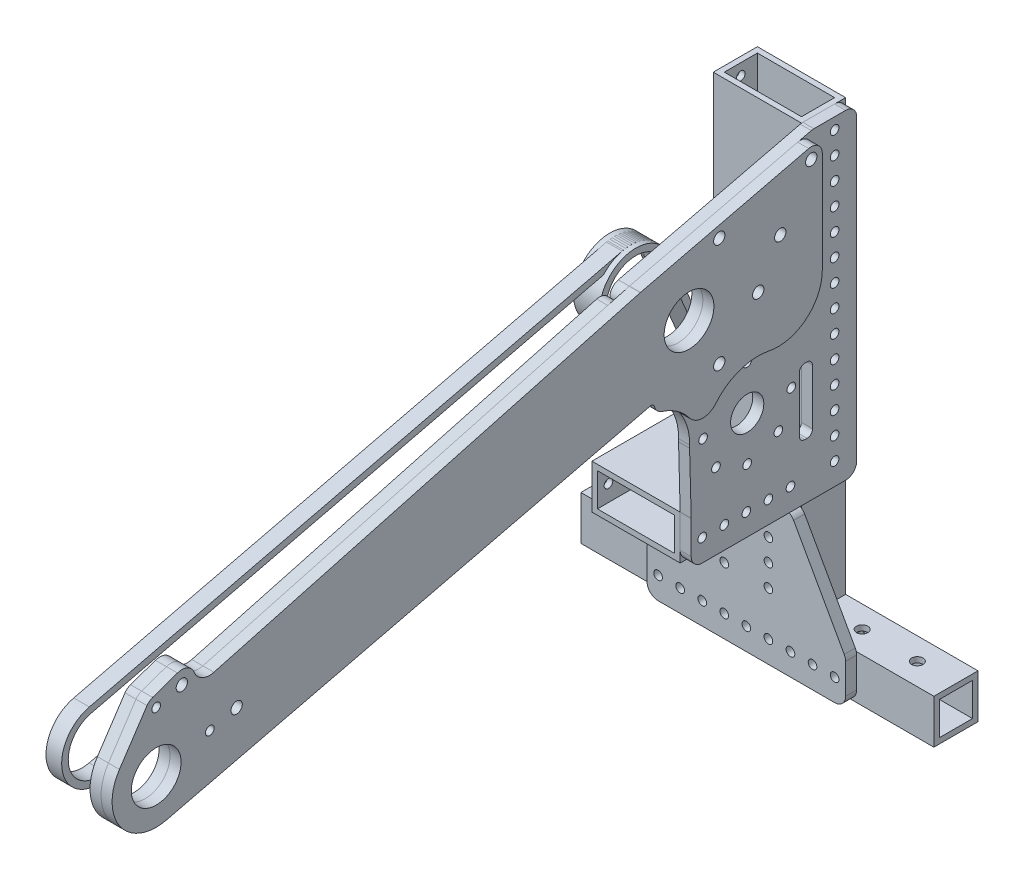
from build123d import *

# Parameters (mm, degrees)
CROQUIS1_W                  = 203.2
CROQUIS1_H                  = 25.4
SALIENTE_EXTRUIR1_DEPTH     = 25.4
VACIADO1_T                  = -3.175
CROQUIS2_W                  = 50.8
CROQUIS2_H                  = 25.4
CROQUIS2_W_2                = 44.45
CROQUIS2_H_2                = 19.05
SALIENTE_EXTRUIR2_DEPTH     = 247.65
CROQUIS3_R                  = 3.2639
CORTAR_EXTRUIR1_DEPTH       = 268.982037644
CROQUIS4_R                  = 14.3129
CROQUIS4_R_2                = 2.4892
CORTAR_EXTRUIR2_DEPTH       = 293.444905068
CROQUIS8_R                  = 2.4892
CORTAR_EXTRUIR4_DEPTH       = 293.444905068
CROQUIS6_W                  = 50.8
CROQUIS6_H                  = 25.4
CROQUIS6_W_2                = 44.45
CROQUIS6_H_2                = 19.05
SALIENTE_EXTRUIR3_DEPTH     = 69.85
CORTAR_EXTRUIR3_DEPTH       = 3.175
CROQUIS9_R                  = 2.4892
SALIENTE_EXTRUIR4_DEPTH     = 6.35
CROQUIS16_R                 = 14.3256
CROQUIS16_R_2               = 2.4892
CROQUIS16_R_3               = 9.5631
SALIENTE_EXTRUIR5_DEPTH     = 6.35
CORTAR_EXTRUIR5_DEPTH       = 326.296833976
CORTAR_EXTRUIR5_DEPTH_BACK  = 326.296833976
CROQUIS12_R                 = 2.4892
SALIENTE_EXTRUIR6_OUTLINE_R = 14.3256
SALIENTE_EXTRUIR6_DEPTH     = 6.35
SALIENTE_EXTRUIR7_START     = -12.7
SALIENTE_EXTRUIR7_OUTLINE_R = 14.3256
SALIENTE_EXTRUIR7_DEPTH     = 6.35
CROQUIS22_R                 = 2.4892
CROQUIS22_R_2               = 3.2639
CORTAR_EXTRUIR6_DEPTH       = 522.908582153
CORTAR_EXTRUIR8_DEPTH       = 521.244846803
SALIENTE_EXTRUIR9_DEPTH     = 4.5
SALIENTE_EXTRUIR10_DEPTH    = 7.5


# Read off the part's stored shape, not the designer's step: Saliente-Extruir6, Saliente-Extruir7
with BuildPart() as part:
    # Croquis1 → Saliente-Extruir1 (new body)
    with BuildSketch(Plane(origin=(0, 0, 0), x_dir=(1, 0, 0), z_dir=(0, 1, 0))):
        Rectangle(CROQUIS1_W, CROQUIS1_H)
    extrude(amount=SALIENTE_EXTRUIR1_DEPTH)

    # Vaciado1
    vaciado1_openings = [part.faces().sort_by_distance(p)[0] for p in [
        (-101.6, 12.7, 0),
        (101.6, 12.7, 0),
    ]]
    offset(amount=VACIADO1_T, openings=vaciado1_openings, kind=Kind.INTERSECTION)

    # Croquis3 → Cortar-Extruir1 (cut, through all)
    with BuildSketch(Plane(origin=(0, 25.4, 0), x_dir=(1, 0, 0), z_dir=(0, 1, 0))):
        with Locations(Location((-47.625, 0, 0), (0, 0, 270))):
            Circle(CROQUIS3_R)
        with Locations(Location((-79.375, 0, 0), (0, 0, 270))):
            Circle(CROQUIS3_R)
        with Locations(Location((79.375, 0, 0), (0, 0, 90))):
            Circle(CROQUIS3_R)
        with Locations(Location((47.625, 0, 0), (0, 0, 90))):
            Circle(CROQUIS3_R)
    extrude(amount=-CORTAR_EXTRUIR1_DEPTH, mode=Mode.SUBTRACT)


with BuildPart() as body_2:
    # Croquis2 → Saliente-Extruir2 (new body)
    with BuildSketch(Plane(origin=(0, 25.4, 0), x_dir=(1, 0, 0), z_dir=(0, 1, 0))):
        Rectangle(CROQUIS2_W, CROQUIS2_H)
        Rectangle(CROQUIS2_W_2, CROQUIS2_H_2, mode=Mode.SUBTRACT)
    extrude(amount=SALIENTE_EXTRUIR2_DEPTH)

    # Croquis4 → Cortar-Extruir2 (cut, through all)
    with BuildSketch(Plane.XY.offset(12.7)):
        with Locations((0, 139.6619)):
            Circle(CROQUIS4_R)
        with Locations((-11.90625, 160.284129928)):
            Circle(CROQUIS4_R_2)
        with Locations((11.90625, 160.284129928)):
            Circle(CROQUIS4_R_2)
        with Locations((11.90625, 119.039670072)):
            Circle(CROQUIS4_R_2)
        with Locations((-11.90625, 119.039670072)):
            Circle(CROQUIS4_R_2)
    extrude(amount=-CORTAR_EXTRUIR2_DEPTH, mode=Mode.SUBTRACT)


with BuildPart() as cortar_extruir4_tool:
    # Croquis8 → Cortar-Extruir4 (new, through all)
    with BuildSketch(Plane.XY.offset(12.7)):
        with Locations((-50.8, 12.7)):
            Circle(CROQUIS8_R)
        with Locations((-38.1, 12.7)):
            Circle(CROQUIS8_R)
        with Locations((-25.4, 12.7)):
            Circle(CROQUIS8_R)
        with Locations((-12.7, 12.7)):
            Circle(CROQUIS8_R)
        with Locations((0, 12.7)):
            Circle(CROQUIS8_R)
        with Locations((12.7, 12.7)):
            Circle(CROQUIS8_R)
        with Locations((25.4, 12.7)):
            Circle(CROQUIS8_R)
        with Locations((38.1, 12.7)):
            Circle(CROQUIS8_R)
        with Locations((50.8, 12.7)):
            Circle(CROQUIS8_R)
        with Locations((12.7, 38.1)):
            Circle(CROQUIS8_R)
        with Locations((-12.7, 50.8)):
            Circle(CROQUIS8_R)
        with Locations((12.7, 50.8)):
            Circle(CROQUIS8_R)
        with Locations((-12.7, 63.5)):
            Circle(CROQUIS8_R)
        with Locations((12.7, 63.5)):
            Circle(CROQUIS8_R)
        with Locations((12.7, 76.2)):
            Circle(CROQUIS8_R)
        with Locations((-12.7, 76.2)):
            Circle(CROQUIS8_R)
        with Locations((-12.7, 38.1)):
            Circle(CROQUIS8_R)
    extrude(amount=-CORTAR_EXTRUIR4_DEPTH)


with BuildPart() as part_1:
    add(part.part)

    # Cortar-Extruir4: cut by cortar_extruir4_tool
    add(cortar_extruir4_tool.part, mode=Mode.SUBTRACT)


with BuildPart() as body_2_1:
    add(body_2.part)

    # Cortar-Extruir4: cut by cortar_extruir4_tool
    add(cortar_extruir4_tool.part, mode=Mode.SUBTRACT)


with BuildPart() as body_3:
    # Croquis6 → Saliente-Extruir3 (new body)
    with BuildSketch(Plane.XY.offset(12.7)):
        with Locations((0, 101.346)):
            Rectangle(CROQUIS6_W, CROQUIS6_H)
        with Locations((0, 101.346)):
            Rectangle(CROQUIS6_W_2, CROQUIS6_H_2, mode=Mode.SUBTRACT)
    extrude(amount=SALIENTE_EXTRUIR3_DEPTH)

    # Croquis7 → Cortar-Extruir3 (cut)
    with BuildSketch(Plane(origin=(0, 114.046, 0), x_dir=(1, 0, 0), z_dir=(0, 1, 0))):
        with BuildLine():
            Line((16.51, -12.7), (-16.51, -12.7))
            Line((-16.51, -12.7), (-16.51, -34.798))
            ThreePointArc((-16.51, -34.798), (-15.542866591, -37.132866591), (-13.208, -38.1))
            Line((-13.208, -38.1), (13.208, -38.1))
            ThreePointArc((13.208, -38.1), (15.542866591, -37.132866591), (16.51, -34.798))
            Line((16.51, -34.798), (16.51, -12.7))
        make_face()
    extrude(amount=-CORTAR_EXTRUIR3_DEPTH, mode=Mode.SUBTRACT)


with BuildPart() as body_4:
    # Croquis9 → Saliente-Extruir4 (new body)
    with BuildSketch(Plane.XY.offset(12.7)):
        with BuildLine():
            Line((50.8, 0), (-50.8, 0))
            ThreePointArc((-50.8, 0), (-55.290128061, 1.859871939), (-57.15, 6.35))
            Line((-57.15, 6.35), (-57.15, 23.748133557))
            ThreePointArc((-57.15, 23.748133557), (-56.945468654, 25.346793942), (-56.345050385, 26.84246971))
            Line((-56.345050385, 26.84246971), (-27.216776701, 79.040336153))
            ThreePointArc((-27.216776701, 79.040336153), (-24.886805275, 81.421926158), (-21.671726315, 82.296))
            Line((-21.671726315, 82.296), (21.671726315, 82.296))
            ThreePointArc((21.671726315, 82.296), (24.886805275, 81.421926158), (27.216776701, 79.040336153))
            Line((27.216776701, 79.040336153), (56.345050385, 26.84246971))
            ThreePointArc((56.345050385, 26.84246971), (56.945468654, 25.346793942), (57.15, 23.748133557))
            Line((57.15, 23.748133557), (57.15, 6.35))
            ThreePointArc((57.15, 6.35), (55.290128061, 1.859871939), (50.8, 0))
        make_face()
        with Locations((-25.4, 12.7)):
            Circle(CROQUIS9_R, mode=Mode.SUBTRACT)
        with Locations((-12.7, 12.7)):
            Circle(CROQUIS9_R, mode=Mode.SUBTRACT)
        with Locations((0, 12.7)):
            Circle(CROQUIS9_R, mode=Mode.SUBTRACT)
        with Locations((12.7, 12.7)):
            Circle(CROQUIS9_R, mode=Mode.SUBTRACT)
        with Locations((-38.1, 12.7)):
            Circle(CROQUIS9_R, mode=Mode.SUBTRACT)
        with Locations((-50.8, 12.7)):
            Circle(CROQUIS9_R, mode=Mode.SUBTRACT)
        with Locations((25.4, 12.7)):
            Circle(CROQUIS9_R, mode=Mode.SUBTRACT)
        with Locations((38.1, 12.7)):
            Circle(CROQUIS9_R, mode=Mode.SUBTRACT)
        with Locations((50.8, 12.7)):
            Circle(CROQUIS9_R, mode=Mode.SUBTRACT)
        with Locations((-12.7, 76.2)):
            Circle(CROQUIS9_R, mode=Mode.SUBTRACT)
        with Locations((12.7, 63.5)):
            Circle(CROQUIS9_R, mode=Mode.SUBTRACT)
        with Locations((-12.7, 63.5)):
            Circle(CROQUIS9_R, mode=Mode.SUBTRACT)
        with Locations((12.7, 50.8)):
            Circle(CROQUIS9_R, mode=Mode.SUBTRACT)
        with Locations((-12.7, 50.8)):
            Circle(CROQUIS9_R, mode=Mode.SUBTRACT)
        with Locations((12.7, 38.1)):
            Circle(CROQUIS9_R, mode=Mode.SUBTRACT)
        with Locations((-12.7, 38.1)):
            Circle(CROQUIS9_R, mode=Mode.SUBTRACT)
        with Locations((12.7, 76.2)):
            Circle(CROQUIS9_R, mode=Mode.SUBTRACT)
    extrude(amount=SALIENTE_EXTRUIR4_DEPTH)


with BuildPart() as body_5:
    # Croquis16 → Saliente-Extruir5 (new body)
    with BuildSketch(Plane(origin=(25.4, 0, 0), x_dir=(0, 0, -1), z_dir=(1, 0, 0))):
        with BuildLine():
            ThreePointArc((-11.945854905, 273.05), (-12.694737131, 273.005685959), (-13.433167074, 272.873362334))
            Line((-13.433167074, 272.873362334), (-118.152464466, 247.643952992))
            ThreePointArc((-118.152464466, 247.643952992), (-122.082067186, 244.784128506), (-122.838514631, 239.983278488))
            Line((-122.838514631, 239.983278488), (-110.011655784, 186.743044919))
            ThreePointArc((-110.011655784, 186.743044919), (-108.476664641, 183.893536514), (-105.736611957, 182.170745975))
            ThreePointArc((-105.736611957, 182.170745975), (-89.428766191, 170.378135102), (-83.486417929, 151.150550701))
            ThreePointArc((-83.486417929, 151.150550701), (-83.494947428, 150.336939284), (-83.483521079, 149.523363394))
            Line((-83.483521079, 149.523363394), (-82.552197171, 114.129500883))
            ThreePointArc((-82.552197171, 114.129500883), (-82.550549317, 114.045992774), (-82.55, 113.962470214))
            Line((-82.55, 113.962470214), (-82.55, 94.996))
            ThreePointArc((-82.55, 94.996), (-80.690128061, 90.505871939), (-76.2, 88.646))
            Line((-76.2, 88.646), (6.35, 88.646))
            ThreePointArc((6.35, 88.646), (10.840128061, 90.505871939), (12.7, 94.996))
            Line((12.7, 94.996), (12.7, 266.7))
            ThreePointArc((12.7, 266.7), (10.840128061, 271.190128061), (6.35, 273.05))
            Line((6.35, 273.05), (-11.945854905, 273.05))
        make_face()
        with Locations((-90.151255112, 219.693162296)):
            Circle(CROQUIS16_R, mode=Mode.SUBTRACT)
        with Locations((-24.92, 150.396)):
            Circle(CROQUIS16_R_2, mode=Mode.SUBTRACT)
        with Locations((-50.32, 175.796)):
            Circle(CROQUIS16_R_2, mode=Mode.SUBTRACT)
        with Locations((-68.280512242, 132.435487758)):
            Circle(CROQUIS16_R_2, mode=Mode.SUBTRACT)
        with Locations((-75.72, 150.396)):
            Circle(CROQUIS16_R_2, mode=Mode.SUBTRACT)
        with Locations((-68.280512242, 168.356512242)):
            Circle(CROQUIS16_R_2, mode=Mode.SUBTRACT)
        with Locations((-50.32, 124.996)):
            Circle(CROQUIS16_R_2, mode=Mode.SUBTRACT)
        with Locations((-32.359487758, 132.435487758)):
            Circle(CROQUIS16_R_2, mode=Mode.SUBTRACT)
        with Locations((-50.32, 150.396)):
            Circle(CROQUIS16_R_3, mode=Mode.SUBTRACT)
    extrude(amount=SALIENTE_EXTRUIR5_DEPTH)


with BuildPart() as cortar_extruir5_tool:
    # Croquis12 → Cortar-Extruir5 (new, two sides: drawn at the far end of the back side and taken through both)
    with BuildSketch(Plane(origin=(25.4, 0, 0), x_dir=(0, 0, -1), z_dir=(1, 0, 0)).offset(-CORTAR_EXTRUIR5_DEPTH_BACK)):
        with Locations((0, 101.346)):
            Circle(CROQUIS12_R)
        with Locations((-25.4, 101.346)):
            Circle(CROQUIS12_R)
        with Locations((-38.1, 101.346)):
            Circle(CROQUIS12_R)
        with Locations((-50.8, 101.346)):
            Circle(CROQUIS12_R)
        with Locations((0, 114.046)):
            Circle(CROQUIS12_R)
        with Locations((0, 126.746)):
            Circle(CROQUIS12_R)
        with Locations((0, 139.446)):
            Circle(CROQUIS12_R)
        with Locations((0, 152.146)):
            Circle(CROQUIS12_R)
        with Locations((0, 164.846)):
            Circle(CROQUIS12_R)
        with Locations((0, 177.546)):
            Circle(CROQUIS12_R)
        with Locations((0, 190.246)):
            Circle(CROQUIS12_R)
        with Locations((0, 202.946)):
            Circle(CROQUIS12_R)
        with Locations((0, 215.646)):
            Circle(CROQUIS12_R)
        with Locations((0, 228.346)):
            Circle(CROQUIS12_R)
        with Locations((0, 241.046)):
            Circle(CROQUIS12_R)
        with Locations((0, 253.746)):
            Circle(CROQUIS12_R)
        with Locations((0, 266.446)):
            Circle(CROQUIS12_R)
        with Locations((-63.5, 101.346)):
            Circle(CROQUIS12_R)
        with Locations((-76.2, 101.346)):
            Circle(CROQUIS12_R)
    extrude(amount=CORTAR_EXTRUIR5_DEPTH + CORTAR_EXTRUIR5_DEPTH_BACK)


with BuildPart() as body_2_2:
    add(body_2_1.part)

    # Cortar-Extruir5: cut by cortar_extruir5_tool
    add(cortar_extruir5_tool.part, mode=Mode.SUBTRACT)


with BuildPart() as body_3_1:
    add(body_3.part)

    # Cortar-Extruir5: cut by cortar_extruir5_tool
    add(cortar_extruir5_tool.part, mode=Mode.SUBTRACT)


with BuildPart() as body_5_1:
    add(body_5.part)

    # Cortar-Extruir5: cut by cortar_extruir5_tool
    add(cortar_extruir5_tool.part, mode=Mode.SUBTRACT)


with BuildPart() as body_6:
    # Saliente-Extruir6 outline → Saliente-Extruir6 (new body)
    with BuildSketch(Plane(origin=(31.75, 0, 0), x_dir=(0, 0, -1), z_dir=(1, 0, 0))):
        with BuildLine():
            Line((-118.238944625, 247.620517484), (-363.676563569, 181.108670077))
            ThreePointArc((-363.676563569, 181.108670077), (-370.4399113, 181.788817808), (-375.02758124, 186.804668483))
            ThreePointArc((-375.02758124, 186.804668483), (-378.93994135, 190.933598772), (-384.621682868, 191.202746084))
            Line((-384.621682868, 191.202746084), (-398.963638861, 186.207448464))
            ThreePointArc((-398.963638861, 186.207448464), (-400.766649089, 185.228500729), (-402.163417908, 183.725762755))
            Line((-402.163417908, 183.725762755), (-418.028671634, 159.855949374))
            ThreePointArc((-418.028671634, 159.855949374), (-417.689660634, 131.238874503), (-390.925751323, 121.102550662))
            Line((-390.925751323, 121.102550662), (-112.402503978, 188.205531619))
            ThreePointArc((-112.402503978, 188.205531619), (-110.904188968, 187.969449143), (-110.011655784, 186.743044919))
            ThreePointArc((-110.011655784, 186.743044919), (-108.476664641, 183.893536514), (-105.736611957, 182.170745975))
            ThreePointArc((-105.736611957, 182.170745975), (-96.891023641, 177.791993994), (-89.81751759, 170.908432872))
            ThreePointArc((-89.81751759, 170.908432872), (-82.410953432, 167.096619642), (-74.838701169, 170.567658162))
            ThreePointArc((-74.838701169, 170.567658162), (-60.908071463, 180.328511466), (-43.938426152, 181.498058055))
            ThreePointArc((-43.938426152, 181.498058055), (-22.778784192, 186.696798455), (-13.433167074, 206.379704498))
            Line((-13.433167074, 206.379704498), (-13.433167074, 264.811802105))
            ThreePointArc((-13.433167074, 264.811802105), (-15.853913473, 269.800135107), (-21.270479244, 270.98516444))
            Line((-21.270479244, 270.98516444), (-118.06535751, 247.664939163))
            ThreePointArc((-118.06535751, 247.664939163), (-118.152307759, 247.643340627), (-118.238944625, 247.620517484))
        make_face()
        with Locations((-396.875, 145.796)):
            Circle(SALIENTE_EXTRUIR6_OUTLINE_R, mode=Mode.SUBTRACT)
        with Locations((-90.151255112, 219.693162296)):
            Circle(SALIENTE_EXTRUIR6_OUTLINE_R, mode=Mode.SUBTRACT)
    extrude(amount=SALIENTE_EXTRUIR6_DEPTH)


with BuildPart() as body_7:
    # Saliente-Extruir7 outline → Saliente-Extruir7 (new body)
    with BuildSketch(Plane(origin=(38.1, 0, 0), x_dir=(0, 0, -1), z_dir=(1, 0, 0)).offset(SALIENTE_EXTRUIR7_START)):
        with BuildLine():
            Line((-402.163417908, 183.725762755), (-418.028671634, 159.855949374))
            ThreePointArc((-418.028671634, 159.855949374), (-417.689660634, 131.238874503), (-390.925751323, 121.102550662))
            Line((-390.925751323, 121.102550662), (-116.649198865, 187.182400197))
            ThreePointArc((-116.649198865, 187.182400197), (-112.719596144, 190.042224683), (-111.9631487, 194.843074701))
            Line((-111.9631487, 194.843074701), (-122.753960879, 239.632322611))
            ThreePointArc((-122.753960879, 239.632322611), (-125.690540946, 243.608135972), (-130.588222498, 244.273951098))
            Line((-130.588222498, 244.273951098), (-363.676563569, 181.108670077))
            ThreePointArc((-363.676563569, 181.108670077), (-370.4399113, 181.788817808), (-375.02758124, 186.804668483))
            ThreePointArc((-375.02758124, 186.804668483), (-378.93994135, 190.933598772), (-384.621682868, 191.202746084))
            Line((-384.621682868, 191.202746084), (-398.963638861, 186.207448464))
            ThreePointArc((-398.963638861, 186.207448464), (-400.766649089, 185.228500729), (-402.163417908, 183.725762755))
        make_face()
        with Locations((-396.875, 145.796)):
            Circle(SALIENTE_EXTRUIR7_OUTLINE_R, mode=Mode.SUBTRACT)
    extrude(amount=SALIENTE_EXTRUIR7_DEPTH)


with BuildPart() as cortar_extruir6_tool:
    # Croquis22 → Cortar-Extruir6 (new, through all)
    with BuildSketch(Plane(origin=(38.1, 0, 0), x_dir=(0, 0, -1), z_dir=(1, 0, 0))):
        with Locations((-396.875, 180.210775411)):
            Circle(CROQUIS22_R)
        with Locations((-350.574782492, 156.950841268)):
            Circle(CROQUIS22_R_2)
        with Locations((-72.746950005, 189.413700796)):
            Circle(CROQUIS22_R_2)
        with Locations((-50.32, 213.896)):
            Circle(CROQUIS22_R_2)
        with Locations((-37.62, 236.121)):
            Circle(CROQUIS22_R_2)
        with Locations((-72.746950005, 252.051546898)):
            Circle(CROQUIS22_R_2)
        with Locations((-19.783167074, 264.811802105)):
            Circle(CROQUIS22_R_2)
        with Locations((-382.115316235, 184.00673842)):
            Circle(CROQUIS22_R_2)
        with Locations((-366.008188328, 153.232560846)):
            Circle(CROQUIS22_R)
    extrude(amount=-CORTAR_EXTRUIR6_DEPTH)


with BuildPart() as body_5_2:
    add(body_5_1.part)

    # Cortar-Extruir6: cut by cortar_extruir6_tool
    add(cortar_extruir6_tool.part, mode=Mode.SUBTRACT)

    # Croquis25 → Cortar-Extruir8 (cut, through all)
    with BuildSketch(Plane(origin=(31.75, 0, 0), x_dir=(0, 0, -1), z_dir=(1, 0, 0))):
        with BuildLine():
            Line((-12.7, 123.825), (-12.7, 155.575))
            ThreePointArc((-12.7, 155.575), (-13.62993597, 157.82006403), (-15.875, 158.75))
            Line((-15.875, 158.75), (-17.145, 158.75))
            ThreePointArc((-17.145, 158.75), (-19.39006403, 157.82006403), (-20.32, 155.575))
            Line((-20.32, 155.575), (-20.32, 123.825))
            ThreePointArc((-20.32, 123.825), (-19.39006403, 121.57993597), (-17.145, 120.65))
            Line((-17.145, 120.65), (-15.875, 120.65))
            ThreePointArc((-15.875, 120.65), (-13.62993597, 121.57993597), (-12.7, 123.825))
        make_face()
    extrude(amount=-CORTAR_EXTRUIR8_DEPTH, mode=Mode.SUBTRACT)


with BuildPart() as body_6_1:
    add(body_6.part)

    # Cortar-Extruir6: cut by cortar_extruir6_tool
    add(cortar_extruir6_tool.part, mode=Mode.SUBTRACT)


with BuildPart() as body_7_1:
    add(body_7.part)

    # Cortar-Extruir6: cut by cortar_extruir6_tool
    add(cortar_extruir6_tool.part, mode=Mode.SUBTRACT)


with BuildPart() as body_8:
    # Croquis29 → Saliente-Extruir9 (new, symmetric)
    with BuildSketch(Plane(origin=(0, 0, 0), x_dir=(0, 0, -1), z_dir=(1, 0, 0))):
        with BuildLine():
            Line((-391.994135012, 125.537073391), (-85.270390124, 199.434235687))
            ThreePointArc((-85.270390124, 199.434235687), (-69.892328503, 224.574027284), (-95.032120101, 239.952088905))
            Line((-95.032120101, 239.952088905), (-401.755864988, 166.054926609))
            ThreePointArc((-401.755864988, 166.054926609), (-417.133926609, 140.915135012), (-391.994135012, 125.537073391))
        make_face()
        with BuildLine():
            Line((-392.884180089, 129.231368961), (-86.160435201, 203.128531257))
            ThreePointArc((-86.160435201, 203.128531257), (-73.586624073, 223.683982206), (-94.142075023, 236.257793334))
            Line((-94.142075023, 236.257793334), (-400.865819911, 162.360631039))
            ThreePointArc((-400.865819911, 162.360631039), (-413.439631039, 141.805180089), (-392.884180089, 129.231368961))
        make_face(mode=Mode.SUBTRACT)
    extrude(amount=SALIENTE_EXTRUIR9_DEPTH, both=True)


with BuildPart() as body_9:
    # Croquis30 → Saliente-Extruir10 (new, symmetric)
    with BuildSketch(Plane(origin=(0, 0, 0), x_dir=(0, 0, -1), z_dir=(1, 0, 0))):
        with BuildLine():
            Line((-106.847935827, 207.224489411), (-59.365417763, 143.641103196))
            ThreePointArc((-59.365417763, 143.641103196), (-44.694162946, 140.608346002), (-39.930317518, 154.812187413))
            Line((-39.930317518, 154.812187413), (-70.973234189, 227.844877688))
            ThreePointArc((-70.973234189, 227.844877688), (-100.53582855, 237.759915875), (-106.847935827, 207.224489411))
        make_face()
        with BuildLine():
            Line((-74.470422322, 226.358380074), (-43.427505652, 153.325689799))
            ThreePointArc((-43.427505652, 153.325689799), (-46.587831075, 143.902890131), (-56.320711852, 145.91481512))
            Line((-56.320711852, 145.91481512), (-103.803229915, 209.498201335))
            ThreePointArc((-103.803229915, 209.498201335), (-98.642160421, 234.465371746), (-74.470422322, 226.358380074))
        make_face(mode=Mode.SUBTRACT)
    extrude(amount=SALIENTE_EXTRUIR10_DEPTH, both=True)


solid = Compound([part_1.part, body_4.part, body_2_2.part, body_3_1.part, body_5_2.part, body_6_1.part, body_7_1.part, body_8.part, body_9.part])
